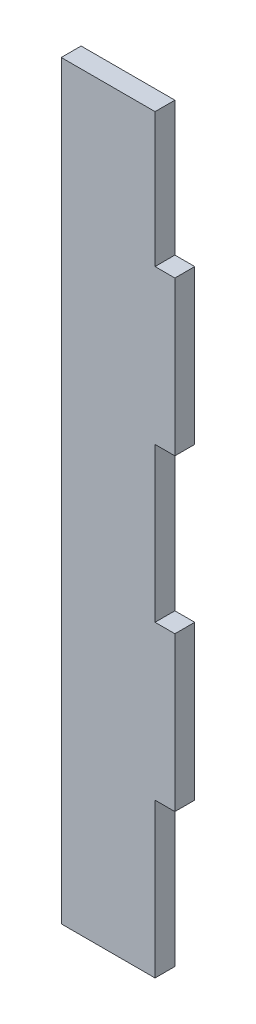
from build123d import *

# Parameters (mm, degrees)
BOSS_EXTRUDE1_DEPTH = 3.175


with BuildPart() as part:
    # Sketch1 → Boss-Extrude1 (new body)
    with BuildSketch(Plane.XY):
        Polygon((0, 0), (15, 0), (15, 24.635), (18.175, 24.635), (18.175, 49.27), (15, 49.27), (15, 73.905), (18.175, 73.905), (18.175, 98.54), (15, 98.54), (15, 120), (0, 120), align=None)
    extrude(amount=BOSS_EXTRUDE1_DEPTH)


solid = part.part
